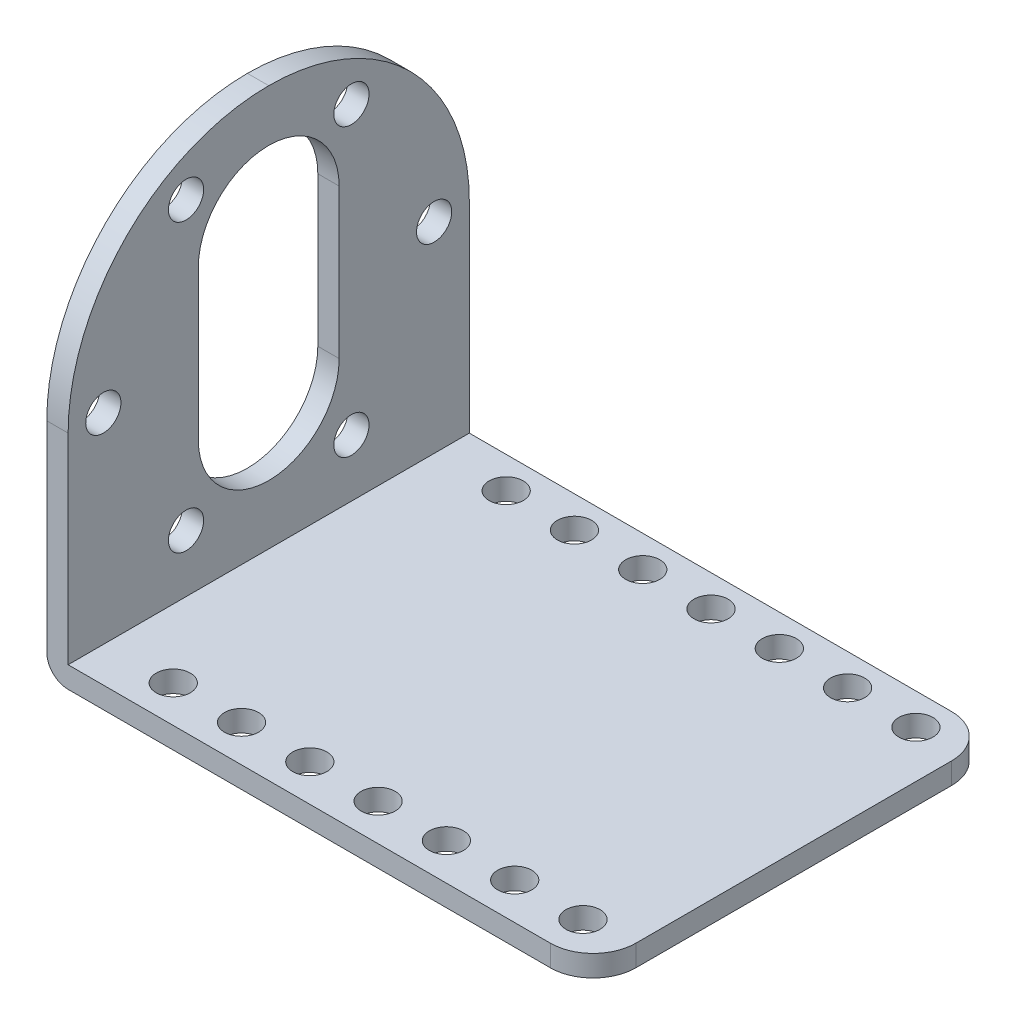
from build123d import *

# Parameters (mm, degrees)
BOSS_EXTRUDE1_DEPTH = 37.6
SKETCH2_R           = 1.65
CUT_EXTRUDE1_DEPTH  = 69.530502022
SKETCH3_R           = 1.6
CUT_EXTRUDE2_DEPTH  = 69.260471168
FILLET1_R           = 18.8
FILLET2_R           = 2
FILLET3_R           = 4


with BuildPart() as part:
    # Sketch1 → Boss-Extrude1 (new body)
    with BuildSketch(Plane.XY):
        Polygon((-8.398458859, 29.360342427), (-6.398458859, 29.360342427), (-6.398458859, -8.239657573), (42.801541141, -8.239657573), (42.801541141, -10.239657573), (-8.398458859, -10.239657573), align=None)
    extrude(amount=BOSS_EXTRUDE1_DEPTH)

    # Sketch2 → Cut-Extrude1 (cut, through all)
    with BuildSketch(Plane(origin=(-6.398458859, 0, 0), x_dir=(0, 0, -1), z_dir=(1, 0, 0))):
        with Locations(Location((-34.3, 10.560342427, 0), (0, 0, 90))):
            Circle(SKETCH2_R)
        with Locations(Location((-26.55, 23.983736186, 0), (0, 0, 90))):
            Circle(SKETCH2_R)
        with Locations(Location((-11.05, 23.983736186, 0), (0, 0, 90))):
            Circle(SKETCH2_R)
        with Locations(Location((-3.3, 10.560342427, 0), (0, 0, 90))):
            Circle(SKETCH2_R)
        with Locations(Location((-11.05, -2.863051332, 0), (0, 0, 90))):
            Circle(SKETCH2_R)
        with Locations(Location((-26.55, -2.863051332, 0), (0, 0, 90))):
            Circle(SKETCH2_R)
        with BuildLine():
            Line((-12.2, 17.909663616), (-12.2, 3.909663616))
            ThreePointArc((-12.2, 3.909663616), (-18.8, -2.690336384), (-25.4, 3.909663616))
            Line((-25.4, 3.909663616), (-25.4, 17.909663616))
            ThreePointArc((-25.4, 17.909663616), (-18.8, 24.509663616), (-12.2, 17.909663616))
        make_face()
    extrude(amount=-CUT_EXTRUDE1_DEPTH, mode=Mode.SUBTRACT)

    # Sketch3 → Cut-Extrude2 (cut, through all)
    with BuildSketch(Plane(origin=(0, -8.239657573, 0), x_dir=(1, 0, 0), z_dir=(0, 1, 0))):
        with Locations(Location((0.001541141, -2.94858142, 0), (0, 0, 270))):
            Circle(SKETCH3_R)
        with Locations(Location((6.401541141, -2.94858142, 0), (0, 0, 270))):
            Circle(SKETCH3_R)
        with Locations(Location((12.801541141, -2.94858142, 0), (0, 0, 270))):
            Circle(SKETCH3_R)
        with Locations(Location((19.201541141, -2.94858142, 0), (0, 0, 270))):
            Circle(SKETCH3_R)
        with Locations(Location((25.601541141, -2.94858142, 0), (0, 0, 270))):
            Circle(SKETCH3_R)
        with Locations(Location((32.001541141, -2.94858142, 0), (0, 0, 270))):
            Circle(SKETCH3_R)
        with Locations(Location((38.401541141, -2.94858142, 0), (0, 0, 270))):
            Circle(SKETCH3_R)
        with Locations(Location((38.401541141, -34.14858142, 0), (0, 0, 90))):
            Circle(SKETCH3_R)
        with Locations(Location((32.001541141, -34.14858142, 0), (0, 0, 90))):
            Circle(SKETCH3_R)
        with Locations(Location((25.601541141, -34.14858142, 0), (0, 0, 90))):
            Circle(SKETCH3_R)
        with Locations(Location((19.201541141, -34.14858142, 0), (0, 0, 90))):
            Circle(SKETCH3_R)
        with Locations(Location((12.801541141, -34.14858142, 0), (0, 0, 90))):
            Circle(SKETCH3_R)
        with Locations(Location((6.401541141, -34.14858142, 0), (0, 0, 90))):
            Circle(SKETCH3_R)
        with Locations(Location((0.001541141, -34.14858142, 0), (0, 0, 90))):
            Circle(SKETCH3_R)
    extrude(amount=-CUT_EXTRUDE2_DEPTH, mode=Mode.SUBTRACT)

    # Fillet1
    fillet1_edges = [part.edges().sort_by_distance(p)[0] for p in [
        (-7.398458859, 29.360342427, 0),
        (-7.398458859, 29.360342427, 37.6),
    ]]
    fillet(fillet1_edges, radius=FILLET1_R - 0.0001)  # a hair under: the kernel refuses the full size

    # Fillet2
    fillet2_edges = [part.edges().sort_by_distance(p)[0] for p in [
        (-8.398458859, -10.239657573, 18.8),
    ]]
    fillet(fillet2_edges, radius=FILLET2_R)

    # Fillet3
    fillet3_edges = [part.edges().sort_by_distance(p)[0] for p in [
        (42.801541141, -9.239657573, 37.6),
        (42.801541141, -9.239657573, 0),
    ]]
    fillet(fillet3_edges, radius=FILLET3_R)


solid = part.part
